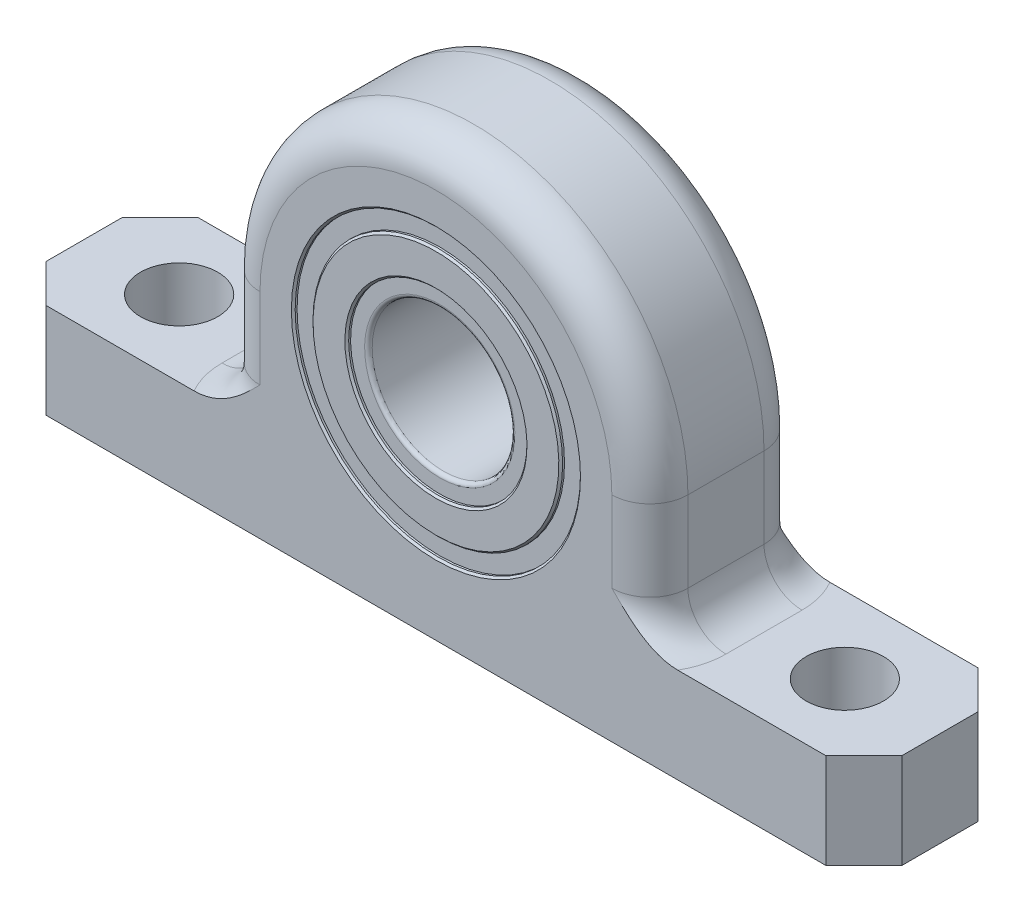
from build123d import *

# Parameters (mm, degrees)
EXTRUDE1_DEPTH      = 5.08
EXTRUDE1_DEPTH_BACK = 5.08
SKETCH3_R           = 9.525
SKETCH4_R           = 2.5796875
CUT_EXTRUDE1_DEPTH  = 37.55526843
FILLET1_R           = 2.54
FILLET2_R           = 2.54
CHAMFER1_SIZE       = 0.127
FILLET3_R           = 0.254
CHAMFER2_SIZE       = 0.127


with BuildPart() as part:
    # Sketch3 → Extrude1 (new, two sides: drawn at the far end of the back side and taken through both)
    with BuildSketch(Plane.XY.offset(-EXTRUDE1_DEPTH_BACK)):
        with BuildLine():
            Line((14.2875, 0), (14.2875, -7.9375))
            Line((14.2875, -7.9375), (28.575, -7.9375))
            Line((28.575, -7.9375), (28.575, -14.2875))
            Line((28.575, -14.2875), (-28.575, -14.2875))
            Line((-28.575, -14.2875), (-28.575, -7.9375))
            Line((-28.575, -7.9375), (-14.2875, -7.9375))
            Line((-14.2875, -7.9375), (-14.2875, 0))
            ThreePointArc((-14.2875, 0), (0, 14.2875), (14.2875, 0))
        make_face()
        Circle(SKETCH3_R, mode=Mode.SUBTRACT)
    extrude(amount=EXTRUDE1_DEPTH + EXTRUDE1_DEPTH_BACK)

    # Sketch4 → Cut-Extrude1 (cut, through all)
    with BuildSketch(Plane(origin=(0, -7.9375, 0), x_dir=(1, 0, 0), z_dir=(0, 1, 0))):
        with Locations(Location((-22.225, 0, 0), (0, 0, 270))):
            Circle(SKETCH4_R)
        with Locations(Location((22.225, 0, 0), (0, 0, 270))):
            Circle(SKETCH4_R)
        Polygon((-28.575, 5.08), (-28.575, 2.54), (-26.035, 5.08), align=None)
        Polygon((26.035, 5.08), (28.575, 5.08), (28.575, 2.54), align=None)
        Polygon((28.575, -5.08), (28.575, -2.54), (26.035, -5.08), align=None)
        Polygon((-26.035, -5.08), (-28.575, -5.08), (-28.575, -2.54), align=None)
    extrude(amount=-CUT_EXTRUDE1_DEPTH, mode=Mode.SUBTRACT)

    # Fillet1
    fillet1_edges = [part.edges().sort_by_distance(p)[0] for p in [
        (0, 14.2875, -5.08),
        (14.2875, -3.96875, -5.08),
        (14.2875, -3.96875, 5.08),
        (-14.2875, -3.96875, -5.08),
        (0, 14.2875, 5.08),
        (-14.2875, -3.96875, 5.08),
    ]]
    fillet(fillet1_edges, radius=FILLET1_R)

    # Fillet2
    # the kernel refuses this fillet: 2.54 mm, written as the material it adds along each edge
    with BuildSketch(Plane(origin=(-14.2875, -7.9375, -2.54), x_dir=(0, 1, 0), z_dir=(0, 0, 1)), Plane(origin=(14.2875, -7.9375, 2.54), x_dir=(0, 1, 0), z_dir=(0, 0, -1))) as fillet2_piece_1:
        with BuildLine():
            CenterArc((FILLET2_R, FILLET2_R), FILLET2_R, 180, 90)
            Line((0, FILLET2_R), (0, 0))
            Line((0, 0), (FILLET2_R, 0))
        make_face()
    extrude(amount=5.08)
    with BuildSketch(Plane(origin=(11.7475, -7.9375, -2.54), x_dir=(-0.5976672776328281, 0, 0.8017442392976479), z_dir=(0.8017442392976479, 0, 0.5976672776328281))) as fillet2_piece_2_section:
        with BuildLine():
            CenterArc((2.54 + FILLET2_R, -FILLET2_R), FILLET2_R, 90, 90)
            Line((2.54 + FILLET2_R, 0), (2.54, 0))
            Line((2.54, 0), (2.54, -FILLET2_R))
        make_face()
    fillet2_piece_2 = revolve(axis=Axis((11.7475, -7.9375, -2.54), (0, -1, 0)), revolution_arc=233.296989237, mode=Mode.PRIVATE)
    fillet2_piece_2 = split(fillet2_piece_2, bisect_by=Plane(origin=(13.652344814, -7.145963779, -5.08), z_dir=(0, 0, 1)), keep=Keep.TOP, mode=Mode.PRIVATE)
    add(fillet2_piece_2)
    with BuildSketch(Plane(origin=(-11.7475, -7.9375, -2.54), x_dir=(0.5976672776328252, 0, 0.8017442392976498), z_dir=(-0.8017442392976498, 0, 0.5976672776328252))) as fillet2_piece_3_section:
        with BuildLine():
            CenterArc((2.54 + FILLET2_R, FILLET2_R), FILLET2_R, 180, 90)
            Line((2.54, FILLET2_R), (2.54, 0))
            Line((2.54, 0), (2.54 + FILLET2_R, 0))
        make_face()
    fillet2_piece_3 = revolve(axis=Axis((-11.7475, -7.9375, -2.54), (0, 1, 0)), revolution_arc=233.296989237, mode=Mode.PRIVATE)
    fillet2_piece_3 = split(fillet2_piece_3, bisect_by=Plane(origin=(-13.652344909, -7.145964282, -5.08), z_dir=(0, 0, 1)), keep=Keep.TOP, mode=Mode.PRIVATE)
    add(fillet2_piece_3)
    with BuildSketch(Plane(origin=(11.7475, -7.9375, 2.54), x_dir=(1, 0, 0), z_dir=(0, 0, -1))) as fillet2_piece_4_section:
        with BuildLine():
            CenterArc((2.54 + FILLET2_R, -FILLET2_R), FILLET2_R, 90, 90)
            Line((2.54 + FILLET2_R, 0), (2.54, 0))
            Line((2.54, 0), (2.54, -FILLET2_R))
        make_face()
    fillet2_piece_4 = revolve(axis=Axis((11.7475, -7.9375, 2.54), (0, -1, 0)), revolution_arc=233.296989237, mode=Mode.PRIVATE)
    fillet2_piece_4 = split(fillet2_piece_4, bisect_by=Plane(origin=(13.65234485, -7.145963968, 5.08), z_dir=(0, 0, -1)), keep=Keep.TOP, mode=Mode.PRIVATE)
    add(fillet2_piece_4)
    with BuildSketch(Plane(origin=(-11.7475, -7.9375, 2.54), x_dir=(-1, 0, 0), z_dir=(0, 0, -1))) as fillet2_piece_5_section:
        with BuildLine():
            CenterArc((2.54 + FILLET2_R, FILLET2_R), FILLET2_R, 180, 90)
            Line((2.54, FILLET2_R), (2.54, 0))
            Line((2.54, 0), (2.54 + FILLET2_R, 0))
        make_face()
    fillet2_piece_5 = revolve(axis=Axis((-11.7475, -7.9375, 2.54), (0, 1, 0)), revolution_arc=233.296989237, mode=Mode.PRIVATE)
    fillet2_piece_5 = split(fillet2_piece_5, bisect_by=Plane(origin=(-14.845729139, -7.512557487, 5.08), z_dir=(0, 0, -1)), keep=Keep.TOP, mode=Mode.PRIVATE)
    add(fillet2_piece_5)

    # Chamfer1
    chamfer1_edges = [part.edges().sort_by_distance(p)[0] for p in [
        (-9.525, 0, 5.08),
        (-9.525, 0, -5.08),
    ]]
    chamfer(chamfer1_edges, length=CHAMFER1_SIZE)

    # Sketch5 → Revolve1 (revolve)
    with BuildSketch(Plane(origin=(0, 0, 0), x_dir=(0, 0, -1), z_dir=(1, 0, 0))):
        Polygon((-4.826, 9.525), (-4.826, 8.334375), (-5.08, 8.334375), (-5.08, 5.953125), (-4.826, 5.953125), (-4.826, 4.7625), (4.826, 4.7625), (4.826, 5.953125), (5.08, 5.953125), (5.08, 8.334375), (4.826, 8.334375), (4.826, 9.525), align=None)
    revolve(axis=Axis((0, 0, 0), (0, 0, 1)))

    # Fillet3
    fillet3_edges = [part.edges().sort_by_distance(p)[0] for p in [
        (0, -4.7625, -4.826),
        (0, -4.7625, 4.826),
    ]]
    fillet(fillet3_edges, radius=FILLET3_R)

    # Chamfer2
    chamfer2_edges = [part.edges().sort_by_distance(p)[0] for p in [
        (0, -8.334375, -5.08),
        (0, -5.953125, -5.08),
        (0, -5.953125, 5.08),
        (0, -8.334375, 5.08),
    ]]
    chamfer(chamfer2_edges, length=CHAMFER2_SIZE)


solid = part.part
